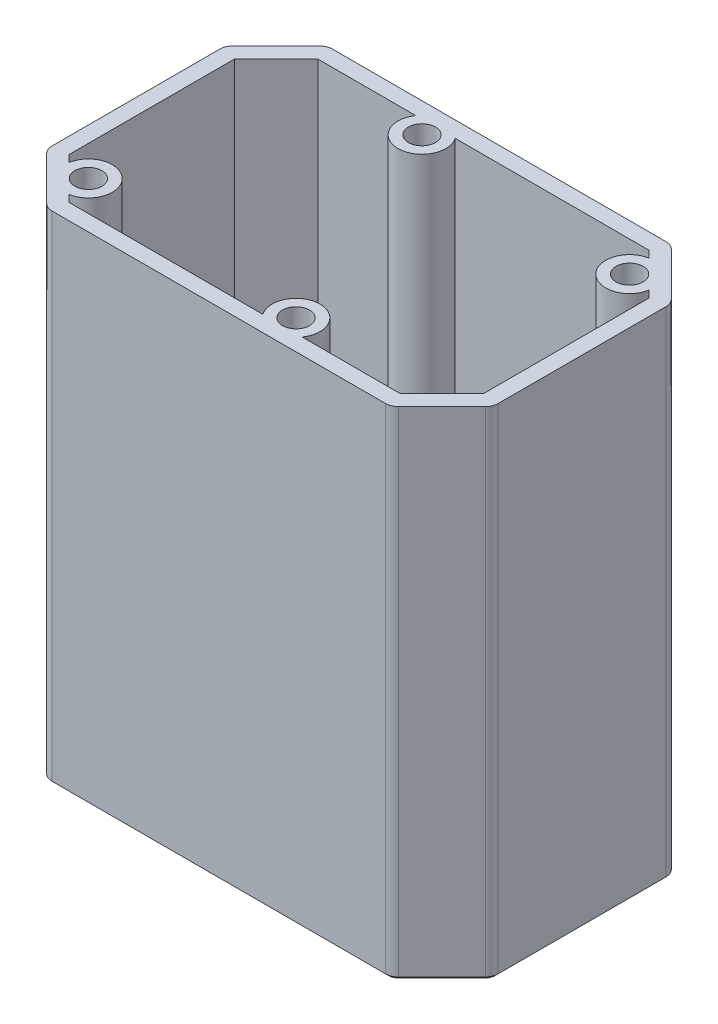
from build123d import *

# Parameters (mm, degrees)
BOSS_EXTRUDE1_DEPTH = 3
SKETCH1_4_R         = 2.125
BOSS_EXTRUDE2_DEPTH = 78
CHAMFER1_SIZE       = 0.5


with BuildPart() as part:
    # Sketch1 → Boss-Extrude1 (new body)
    with BuildSketch(Plane(origin=(0, 0, 0), x_dir=(1, 0, 0), z_dir=(0, 1, 0))):
        with BuildLine():
            Line((26.171572875, 22), (-26.171572875, 22))
            ThreePointArc((-26.171572875, 22), (-26.93693974, 21.847759065), (-27.585786438, 21.414213562))
            Line((-27.585786438, 21.414213562), (-34.414213562, 14.585786438))
            ThreePointArc((-34.414213562, 14.585786438), (-34.847759065, 13.93693974), (-35, 13.171572875))
            Line((-35, 13.171572875), (-35, -13.171572875))
            ThreePointArc((-35, -13.171572875), (-34.847759065, -13.93693974), (-34.414213562, -14.585786438))
            Line((-34.414213562, -14.585786438), (-27.585786438, -21.414213562))
            ThreePointArc((-27.585786438, -21.414213562), (-26.93693974, -21.847759065), (-26.171572875, -22))
            Line((-26.171572875, -22), (26.171572875, -22))
            ThreePointArc((26.171572875, -22), (26.93693974, -21.847759065), (27.585786438, -21.414213562))
            Line((27.585786438, -21.414213562), (34.414213562, -14.585786438))
            ThreePointArc((34.414213562, -14.585786438), (34.847759065, -13.93693974), (35, -13.171572875))
            Line((35, -13.171572875), (35, 13.171572875))
            ThreePointArc((35, 13.171572875), (34.847759065, 13.93693974), (34.414213562, 14.585786438))
            Line((34.414213562, 14.585786438), (27.585786438, 21.414213562))
            ThreePointArc((27.585786438, 21.414213562), (26.93693974, 21.847759065), (26.171572875, 22))
        make_face()
    extrude(amount=BOSS_EXTRUDE1_DEPTH)

    # Sketch1<4> → Boss-Extrude2 (add)
    with BuildSketch(Plane(origin=(0, 0, 0), x_dir=(1, 0, 0), z_dir=(0, 1, 0))):
        with BuildLine():
            ThreePointArc((27.585786438, 21.414213562), (26.93693974, 21.847759065), (26.171572875, 22))
            Line((26.171572875, 22), (-26.171572875, 22))
            ThreePointArc((-26.171572875, 22), (-26.93693974, 21.847759065), (-27.585786438, 21.414213562))
            Line((-27.585786438, 21.414213562), (-34.414213562, 14.585786438))
            ThreePointArc((-34.414213562, 14.585786438), (-34.847759065, 13.93693974), (-35, 13.171572875))
            Line((-35, 13.171572875), (-35, -13.171572875))
            ThreePointArc((-35, -13.171572875), (-34.847759065, -13.93693974), (-34.414213562, -14.585786438))
            Line((-34.414213562, -14.585786438), (-27.585786438, -21.414213562))
            ThreePointArc((-27.585786438, -21.414213562), (-26.93693974, -21.847759065), (-26.171572875, -22))
            Line((-26.171572875, -22), (26.171572875, -22))
            ThreePointArc((26.171572875, -22), (26.93693974, -21.847759065), (27.585786438, -21.414213562))
            Line((27.585786438, -21.414213562), (34.414213562, -14.585786438))
            ThreePointArc((34.414213562, -14.585786438), (34.847759065, -13.93693974), (35, -13.171572875))
            Line((35, -13.171572875), (35, 13.171572875))
            ThreePointArc((35, 13.171572875), (34.847759065, 13.93693974), (34.414213562, 14.585786438))
            Line((34.414213562, 14.585786438), (27.585786438, 21.414213562))
        make_face()
        with BuildLine():
            Line((-32.5, -12.964466094), (-32.5, 12.964466094))
            Line((-32.5, 12.964466094), (-25.964466094, 19.5))
            Line((-25.964466094, 19.5), (-10.589801774, 19.5))
            ThreePointArc((-10.589801774, 19.5), (-7.5, 13.625), (-4.410198226, 19.5))
            Line((-4.410198226, 19.5), (25.964466094, 19.5))
            Line((25.964466094, 19.5), (27.04741326, 18.417052834))
            ThreePointArc((27.04741326, 18.417052834), (25.077980708, 12.077980708), (31.417052834, 14.04741326))
            Line((31.417052834, 14.04741326), (32.5, 12.964466094))
            Line((32.5, 12.964466094), (32.5, -12.964466094))
            Line((32.5, -12.964466094), (25.964466094, -19.5))
            Line((25.964466094, -19.5), (10.589801774, -19.5))
            ThreePointArc((10.589801774, -19.5), (7.5, -13.625), (4.410198226, -19.5))
            Line((4.410198226, -19.5), (-25.964466094, -19.5))
            Line((-25.964466094, -19.5), (-27.04741326, -18.417052834))
            ThreePointArc((-27.04741326, -18.417052834), (-25.077980708, -12.077980708), (-31.417052834, -14.04741326))
            Line((-31.417052834, -14.04741326), (-32.5, -12.964466094))
        make_face(mode=Mode.SUBTRACT)
        with Locations((-27.729631137, -14.729631137)):
            Circle(SKETCH1_4_R, mode=Mode.SUBTRACT)
        with Locations((7.5, -17.375)):
            Circle(SKETCH1_4_R, mode=Mode.SUBTRACT)
        with Locations((27.729631137, 14.729631137)):
            Circle(SKETCH1_4_R, mode=Mode.SUBTRACT)
        with Locations((-7.5, 17.375)):
            Circle(SKETCH1_4_R, mode=Mode.SUBTRACT)
    extrude(amount=BOSS_EXTRUDE2_DEPTH)

    # Chamfer1
    chamfer1_edges = [part.edges().sort_by_distance(p)[0] for p in [
        (0, 0, 22),
        (26.93693974, 0, 21.847759065),
        (31, 0, 18),
        (34.847759065, 0, 13.93693974),
        (35, 0, 0),
        (34.847759065, 0, -13.93693974),
        (31, 0, -18),
        (26.93693974, 0, -21.847759065),
        (0, 0, -22),
        (-26.93693974, 0, -21.847759065),
        (-31, 0, -18),
        (-34.847759065, 0, -13.93693974),
        (-35, 0, 0),
        (-34.847759065, 0, 13.93693974),
        (-31, 0, 18),
        (-26.93693974, 0, 21.847759065),
    ]]
    chamfer(chamfer1_edges, length=CHAMFER1_SIZE)


solid = part.part
